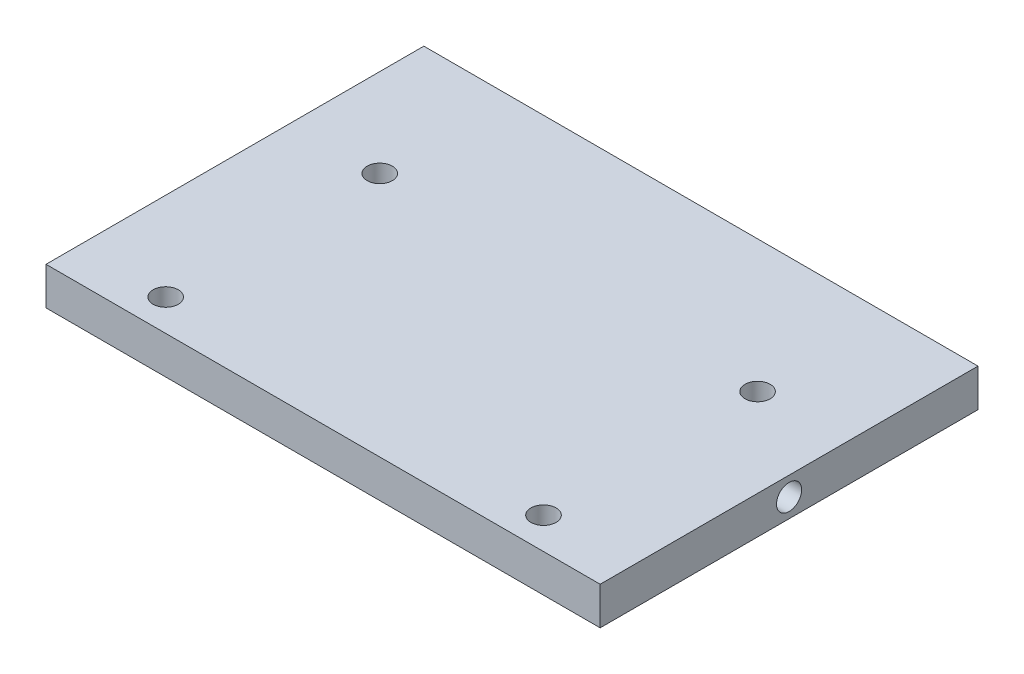
from build123d import *

# Parameters (mm, degrees)
SKETCH1_W           = 44
SKETCH1_H           = 30
BOSS_EXTRUDE1_DEPTH = 3
SKETCH2_R           = 1
CUT_EXTRUDE1_DEPTH  = 5
SKETCH3_R           = 1
CUT_EXTRUDE2_DEPTH  = 5


with BuildPart() as part:
    # Sketch1 → Boss-Extrude1 (new body)
    with BuildSketch(Plane(origin=(0, 0, 0), x_dir=(1, 0, 0), z_dir=(0, 1, 0))):
        Rectangle(SKETCH1_W, SKETCH1_H)
    extrude(amount=BOSS_EXTRUDE1_DEPTH)

    # Sketch2 → Cut-Extrude1 (cut)
    with BuildSketch(Plane.ZY.offset(22)):
        with Locations((0, 1.5)):
            Circle(SKETCH2_R)
    cut_extrude1 = extrude(amount=-CUT_EXTRUDE1_DEPTH, mode=Mode.SUBTRACT)

    # Mirror1: Cut-Extrude1 across plane
    add(cut_extrude1.mirror(Plane(origin=(0, 0, 0), x_dir=(0, 0, 1), z_dir=(1, 0, 0))), mode=Mode.SUBTRACT)

    # Sketch3 → Cut-Extrude2 (cut)
    with BuildSketch(Plane(origin=(0, 0, 0), x_dir=(-1, 0, 0), z_dir=(0, -1, 0))):
        with Locations((15, 4.5)):
            Circle(SKETCH3_R)
        with Locations((15, -12.5)):
            Circle(SKETCH3_R)
        with Locations((-15, -12.5)):
            Circle(SKETCH3_R)
        with Locations((-15, 4.5)):
            Circle(SKETCH3_R)
    extrude(amount=-CUT_EXTRUDE2_DEPTH, mode=Mode.SUBTRACT)


solid = part.part
